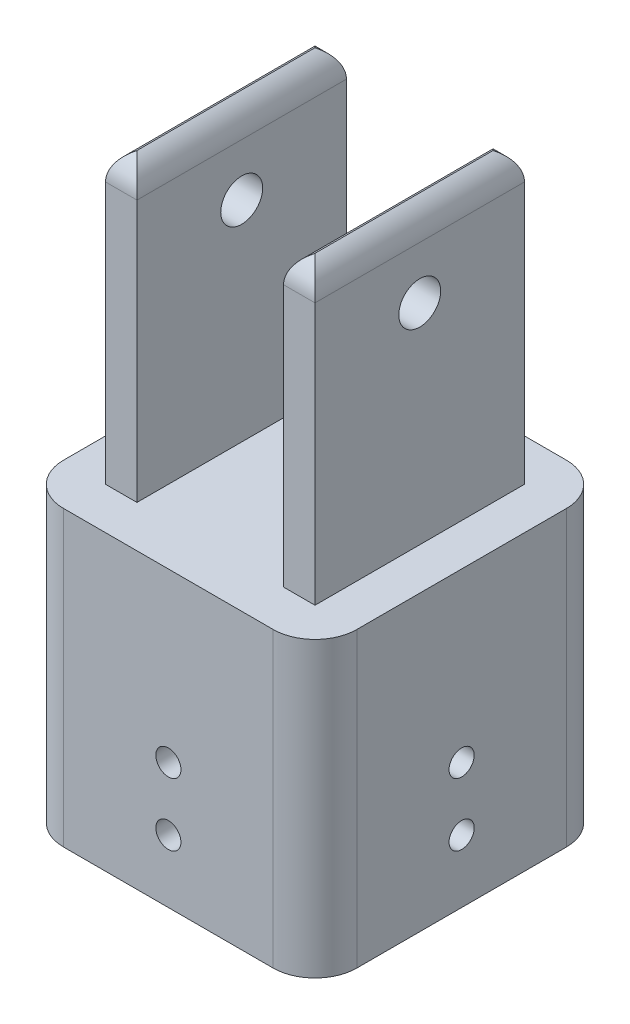
from build123d import *

# Parameters (mm, degrees)
SKETCH1_W           = 50
SKETCH1_H           = 50
BOSS_EXTRUDE1_DEPTH = 70
SKETCH3_W           = 35
SKETCH3_H           = 50
CUT_EXTRUDE1_DEPTH  = 120
SKETCH4_R           = 5
CUT_EXTRUDE2_DEPTH  = 14
FILLET2_R           = 7.5
BOSS_EXTRUDE2_DEPTH = 70
FILLET4_R           = 10
CUT_EXTRUDE10_DEPTH = 45
SKETCH10_R          = 3
CUT_EXTRUDE6_DEPTH  = 10
SKETCH12_R          = 3
CUT_EXTRUDE7_DEPTH  = 10
SKETCH13_R          = 3
CUT_EXTRUDE8_DEPTH  = 10
SKETCH14_R          = 3
CUT_EXTRUDE9_DEPTH  = 10
FILLET5_R           = 7.5
SKETCH16_R          = 5
CUT_EXTRUDE12_DEPTH = 10
SKETCH17_R          = 5
CUT_EXTRUDE13_DEPTH = 50


with BuildPart() as part:
    # Sketch1 → Boss-Extrude1 (new body)
    with BuildSketch(Plane(origin=(0, 0, 0), x_dir=(1, 0, 0), z_dir=(0, 1, 0))):
        with Locations((25, 25)):
            Rectangle(SKETCH1_W, SKETCH1_H)
    extrude(amount=BOSS_EXTRUDE1_DEPTH)

    # Sketch3 → Cut-Extrude1 (cut)
    with BuildSketch(Plane(origin=(0, 70, 0), x_dir=(1, 0, 0), z_dir=(0, 1, 0))):
        with Locations((25, 25)):
            Rectangle(SKETCH3_W, SKETCH3_H)
    extrude(amount=-CUT_EXTRUDE1_DEPTH, mode=Mode.SUBTRACT)


with BuildPart() as cut_extrude1_piece_1:
    # of the separate pieces the step leaves, piece 1, a body of its own (cut_extrude1_pieces)
    add(part.part.solids().sort_by_distance((42.5, 0, 0))[0])

    # Fillet2
    # the kernel refuses this fillet: 7.5 mm, written as the material it takes off along each edge
    with BuildSketch(Plane(origin=(50, 70, 18.75), x_dir=(0, -1, 0), z_dir=(0, 0, -1))) as fillet2_piece_1:
        with BuildLine():
            CenterArc((FILLET2_R, FILLET2_R), FILLET2_R, 180, 90)
            Line((0, FILLET2_R), (0, 0))
            Line((0, 0), (FILLET2_R, 0))
        make_face()
    extrude(amount=87.5, mode=Mode.SUBTRACT)
    with BuildSketch(Plane(origin=(23.75, 70, 0), x_dir=(0, -1, 0), z_dir=(1, 0, 0))) as fillet2_piece_2:
        with BuildLine():
            CenterArc((FILLET2_R, FILLET2_R), FILLET2_R, 180, 90)
            Line((0, FILLET2_R), (0, 0))
            Line((0, 0), (FILLET2_R, 0))
        make_face()
    extrude(amount=45, mode=Mode.SUBTRACT)
    with BuildSketch(Plane(origin=(68.75, 70, -50), x_dir=(0, 0, 1), z_dir=(-1, 0, 0))) as fillet2_piece_3:
        with BuildLine():
            CenterArc((FILLET2_R, -FILLET2_R), FILLET2_R, 90, 90)
            Line((0, -FILLET2_R), (0, 0))
            Line((0, 0), (FILLET2_R, 0))
        make_face()
    extrude(amount=45, mode=Mode.SUBTRACT)
    with BuildSketch(Plane(origin=(42.5, 70, -68.75), x_dir=(1, 0, 0), z_dir=(0, 0, 1))) as fillet2_piece_4:
        with BuildLine():
            CenterArc((FILLET2_R, -FILLET2_R), FILLET2_R, 90, 90)
            Line((0, -FILLET2_R), (0, 0))
            Line((0, 0), (FILLET2_R, 0))
        make_face()
    extrude(amount=87.5, mode=Mode.SUBTRACT)

    # Sketch16 → Cut-Extrude12 (cut)
    with BuildSketch(Plane.ZY.offset(-42.5)):
        with Locations((-25, 50)):
            Circle(SKETCH16_R)
    extrude(amount=-CUT_EXTRUDE12_DEPTH, mode=Mode.SUBTRACT)


with BuildPart() as cut_extrude1_piece_2:
    # of the separate pieces the step leaves, piece 2, a body of its own (cut_extrude1_pieces)
    add(part.part.solids().sort_by_distance((0, 0, 0))[0])

    # Sketch4 → Cut-Extrude2 (cut)
    with BuildSketch(Plane.ZY):
        with Locations((-25, 50)):
            Circle(SKETCH4_R)
    extrude(amount=-CUT_EXTRUDE2_DEPTH, mode=Mode.SUBTRACT)

    # Sketch6 → Boss-Extrude2 (add)
    with BuildSketch(Plane(origin=(0, 0, 0), x_dir=(-1, 0, 0), z_dir=(0, -1, 0))):
        Polygon((-60, 0), (-60, -10), (10, -10), (10, 60), (-60, 60), align=None)
    extrude(amount=BOSS_EXTRUDE2_DEPTH)

    # Fillet4
    fillet4_edges = [cut_extrude1_piece_2.edges().sort_by_distance(p)[0] for p in [
        (60, -35, -60),
        (60, -35, 10),
        (-10, -35, 10),
        (-10, -35, -60),
    ]]
    fillet(fillet4_edges, radius=FILLET4_R)

    # Sketch15 → Cut-Extrude10 (cut)
    with BuildSketch(Plane.XZ.offset(70)):
        with BuildLine():
            Line((10, 0), (40, 0))
            ThreePointArc((40, 0), (47.071067812, -2.928932188), (50, -10))
            Line((50, -10), (50, -40))
            ThreePointArc((50, -40), (47.071067812, -47.071067812), (40, -50))
            Line((40, -50), (10, -50))
            ThreePointArc((10, -50), (2.928932188, -47.071067812), (0, -40))
            Line((0, -40), (0, -10))
            ThreePointArc((0, -10), (2.928932188, -2.928932188), (10, 0))
        make_face()
    extrude(amount=-CUT_EXTRUDE10_DEPTH, mode=Mode.SUBTRACT)

    # Sketch10 → Cut-Extrude6 (cut)
    with BuildSketch(Plane.ZY.offset(10)):
        with Locations((-25, -40)):
            Circle(SKETCH10_R)
        with Locations((-25, -55)):
            Circle(SKETCH10_R)
    extrude(amount=-CUT_EXTRUDE6_DEPTH, mode=Mode.SUBTRACT)

    # Sketch12 → Cut-Extrude7 (cut)
    with BuildSketch(Plane(origin=(0, 0, -60), x_dir=(-1, 0, 0), z_dir=(0, 0, -1))):
        with Locations((-25, -40)):
            Circle(SKETCH12_R)
        with Locations((-25, -55)):
            Circle(SKETCH12_R)
    extrude(amount=-CUT_EXTRUDE7_DEPTH, mode=Mode.SUBTRACT)

    # Sketch13 → Cut-Extrude8 (cut)
    with BuildSketch(Plane(origin=(60, 0, 0), x_dir=(0, 0, -1), z_dir=(1, 0, 0))):
        with Locations(Location((25, -40, 0), (0, 0, 180))):
            Circle(SKETCH13_R)
        with Locations(Location((25, -55, 0), (0, 0, 180))):
            Circle(SKETCH13_R)
    extrude(amount=-CUT_EXTRUDE8_DEPTH, mode=Mode.SUBTRACT)

    # Sketch14 → Cut-Extrude9 (cut)
    with BuildSketch(Plane.XY.offset(10)):
        with Locations(Location((25, -40, 0), (0, 0, 180))):
            Circle(SKETCH14_R)
        with Locations(Location((25, -55, 0), (0, 0, 180))):
            Circle(SKETCH14_R)
    extrude(amount=-CUT_EXTRUDE9_DEPTH, mode=Mode.SUBTRACT)

    # Fillet5
    # the kernel refuses this fillet: 7.5 mm, written as the material it takes off along each edge
    with BuildSketch(Plane(origin=(26.25, 70, -50), x_dir=(0, -1, 0), z_dir=(-1, 0, 0)), Plane(origin=(-18.75, 70, 0), x_dir=(0, -1, 0), z_dir=(1, 0, 0))) as fillet5_piece_1:
        with BuildLine():
            CenterArc((FILLET5_R, FILLET5_R), FILLET5_R, 180, 90)
            Line((0, FILLET5_R), (0, 0))
            Line((0, 0), (FILLET5_R, 0))
        make_face()
    extrude(amount=45, mode=Mode.SUBTRACT)
    with BuildSketch(Plane(origin=(0, 70, -68.75), x_dir=(0, -1, 0), z_dir=(0, 0, 1)), Plane(origin=(7.5, 70, 18.75), x_dir=(0, -1, 0), z_dir=(0, 0, -1))) as fillet5_piece_2:
        with BuildLine():
            CenterArc((FILLET5_R, FILLET5_R), FILLET5_R, 180, 90)
            Line((0, FILLET5_R), (0, 0))
            Line((0, 0), (FILLET5_R, 0))
        make_face()
    extrude(amount=87.5, mode=Mode.SUBTRACT)

    # Sketch17 → Cut-Extrude13 (cut)
    with BuildSketch(Plane(origin=(0, 0, 0), x_dir=(1, 0, 0), z_dir=(0, 1, 0))):
        with Locations(Location((25, 25, 0), (0, 0, 270))):
            Circle(SKETCH17_R)
    extrude(amount=-CUT_EXTRUDE13_DEPTH, mode=Mode.SUBTRACT)


solid = Compound([cut_extrude1_piece_1.part, cut_extrude1_piece_2.part])
